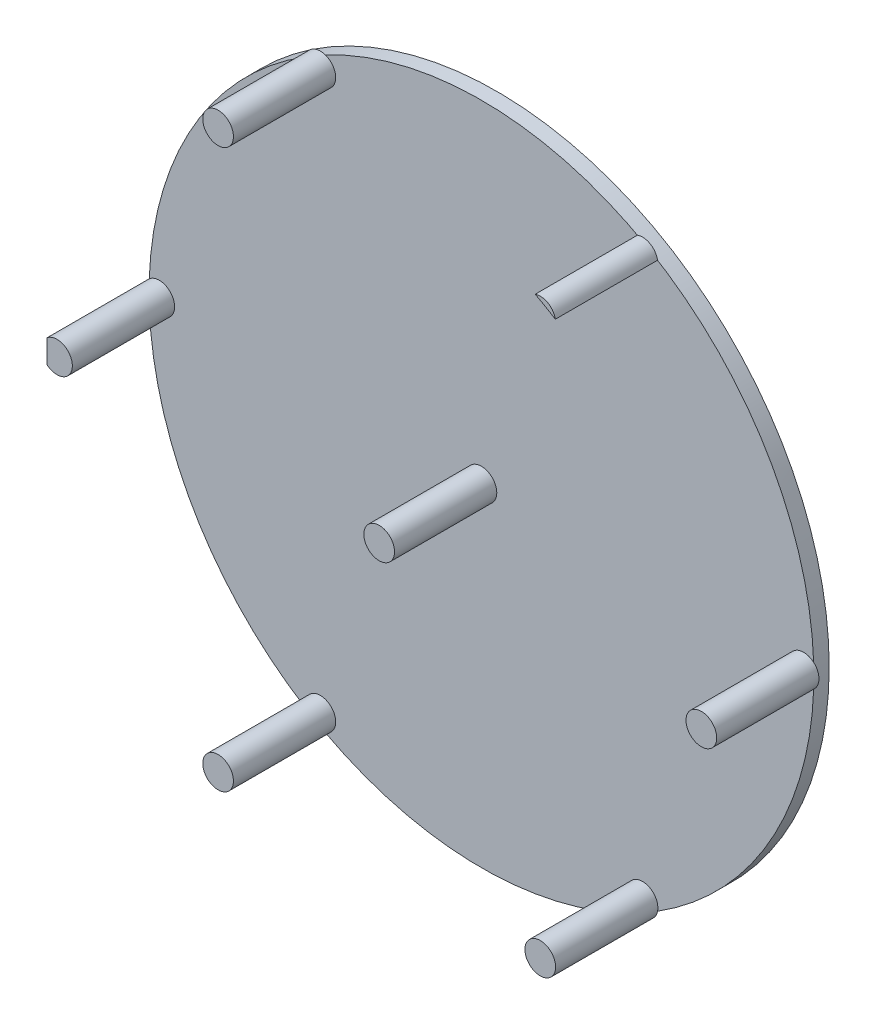
from build123d import *

# Parameters (mm, degrees)
SKETCH_1_R          = 65
EXTRUDE_1_DEPTH     = 3
EXTRUDE_2_OUTLINE_R = 3
EXTRUDE_2_DEPTH     = 20
SKETCH_3_R          = 3
EXTRUDE_3_DEPTH     = 20


# Read off the part's stored shape, not the designer's step: 凸台-拉伸2
with BuildPart() as part:
    # 草图1 → 凸台-拉伸1 (new body)
    with BuildSketch(Plane.XY):
        Circle(SKETCH_1_R)
    extrude(amount=-EXTRUDE_1_DEPTH)

    # 凸台-拉伸2 outline → 凸台-拉伸2 (add)
    with BuildSketch(Plane.XY):
        with BuildLine():
            ThreePointArc((34.446847976, 55.121816593), (33, 57.15767665), (30.513469484, 57.392753724))
            ThreePointArc((30.513469484, 57.392753724), (32.5, 56.291651246), (34.446847976, 55.121816593))
        make_face()
        with Locations((-31.5, 54.559600438)):
            Circle(EXTRUDE_2_OUTLINE_R)
        with Locations((63, 0)):
            Circle(EXTRUDE_2_OUTLINE_R)
        with BuildLine():
            ThreePointArc((-64.96031746, -2.270937131), (-60, 0), (-64.96031746, 2.270937131))
            ThreePointArc((-64.96031746, 2.270937131), (-65, 0), (-64.96031746, -2.270937131))
        make_face()
        with Locations((31.5, -54.559600438)):
            Circle(EXTRUDE_2_OUTLINE_R)
        with Locations((-31.5, -54.559600438)):
            Circle(EXTRUDE_2_OUTLINE_R)
    extrude(amount=EXTRUDE_2_DEPTH)

    # 草图3 → 凸台-拉伸3 (add)
    with BuildSketch(Plane.XY):
        Circle(SKETCH_3_R)
    extrude(amount=EXTRUDE_3_DEPTH)


solid = part.part
